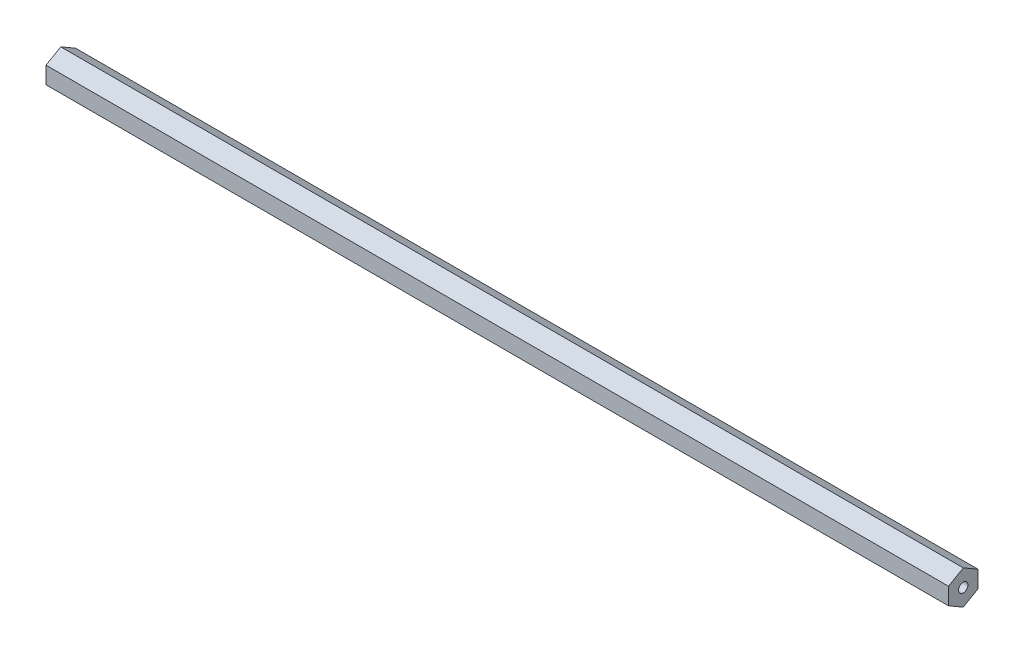
from build123d import *

# Parameters (mm, degrees)
BOSS_EXTRUDE1_DEPTH                  = 194.437
F_10_32_TAPPED_HOLE2_D               = 4.0386
F_10_32_TAPPED_HOLE2_DEPTH           = 16.34744
F_10_32_TAPPED_HOLE2_TIP             = 1.213317848
F_10_32_TAPPED_HOLE2_ON_FACE_2_D     = 4.0386
F_10_32_TAPPED_HOLE2_ON_FACE_2_DEPTH = 16.34744
F_10_32_TAPPED_HOLE2_ON_FACE_2_TIP   = 1.213317848


with BuildPart() as part:
    # Sketch1 → Boss-Extrude1 (new, symmetric)
    with BuildSketch(Plane(origin=(0, 0, 0), x_dir=(0, 0, -1), z_dir=(1, 0, 0))):
        Polygon((6.35, 3.666174209), (0, 7.332348419), (-6.35, 3.666174209), (-6.35, -3.666174209), (0, -7.332348419), (6.35, -3.666174209), align=None)
    extrude(amount=BOSS_EXTRUDE1_DEPTH, both=True)

    # #10-32 Tapped Hole2
    with Locations(Plane(origin=(194.437, 0, 0), x_dir=(0, 0, 1), z_dir=(1, 0, 0))):
        with Locations((0, 0)):
            Hole(F_10_32_TAPPED_HOLE2_D / 2, depth=F_10_32_TAPPED_HOLE2_DEPTH)
            with Locations((0, 0, -(F_10_32_TAPPED_HOLE2_DEPTH + F_10_32_TAPPED_HOLE2_TIP / 2))):  # 118° drill point
                Cone(0, F_10_32_TAPPED_HOLE2_D / 2, F_10_32_TAPPED_HOLE2_TIP, mode=Mode.SUBTRACT)

    # #10-32 Tapped Hole2 on face 2
    with Locations(Plane(origin=(-194.437, 0, 0), x_dir=(0, 0, -1), z_dir=(-1, 0, 0))):
        with Locations((0, 0)):
            Hole(F_10_32_TAPPED_HOLE2_ON_FACE_2_D / 2, depth=F_10_32_TAPPED_HOLE2_ON_FACE_2_DEPTH)
            with Locations((0, 0, -(F_10_32_TAPPED_HOLE2_ON_FACE_2_DEPTH + F_10_32_TAPPED_HOLE2_ON_FACE_2_TIP / 2))):  # 118° drill point
                Cone(0, F_10_32_TAPPED_HOLE2_ON_FACE_2_D / 2, F_10_32_TAPPED_HOLE2_ON_FACE_2_TIP, mode=Mode.SUBTRACT)


solid = part.part
